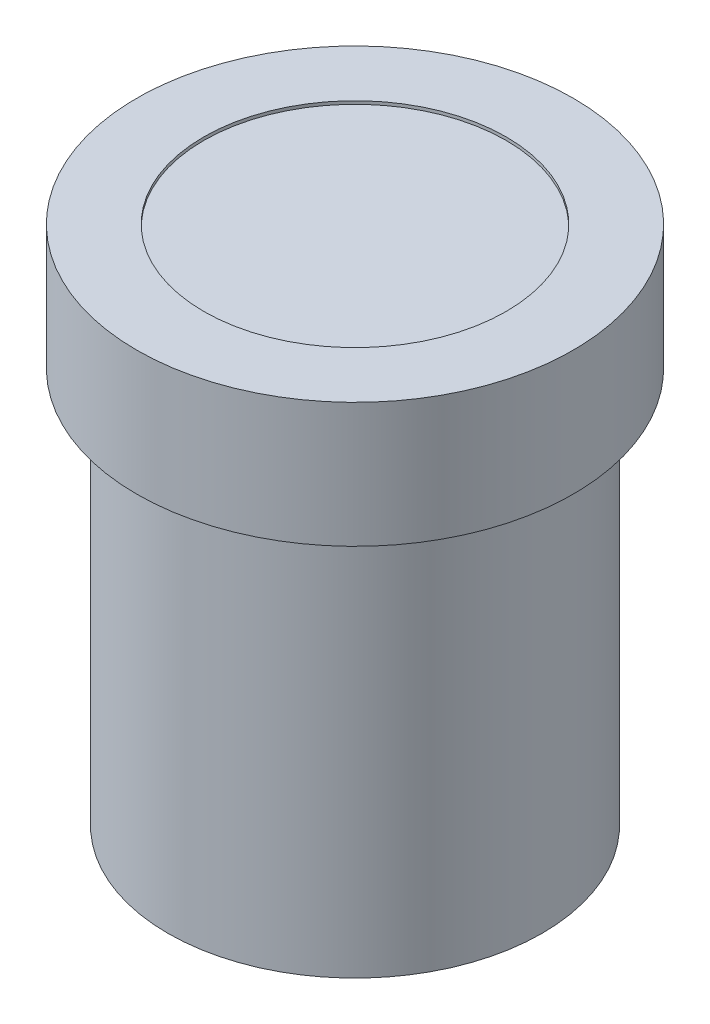
from build123d import *

# Parameters (mm, degrees)
SKETCH1_R           = 6
SKETCH1_R_2         = 2.25
BOSS_EXTRUDE1_DEPTH = 12.7
SKETCH2_R           = 7
SKETCH2_R_2         = 6
SKETCH2_R_3         = 4.85
BOSS_EXTRUDE2_DEPTH = 4
BOSS_EXTRUDE3_START = 3.8
SKETCH2_2_R         = 4.85
BOSS_EXTRUDE3_DEPTH = 0.1
SKETCH2_6_R         = 2.25
BOSS_EXTRUDE4_DEPTH = 0.1


# Read off the part's stored shape, not the designer's step: Dome1
with BuildPart() as part:
    # Sketch1 → Boss-Extrude1 (new body)
    with BuildSketch(Plane(origin=(0, 0, 0), x_dir=(1, 0, 0), z_dir=(0, 1, 0))):
        with Locations(Location((0, 0, 0), (0, 0, 270))):
            Circle(SKETCH1_R)
        with Locations(Location((0, 0, 0), (0, 0, 270))):
            Circle(SKETCH1_R_2, mode=Mode.SUBTRACT)
    extrude(amount=BOSS_EXTRUDE1_DEPTH)

    # Sketch2 → Boss-Extrude2 (add)
    # profile 1 of 2: a face of its own
    with BuildSketch(Plane(origin=(0, 12.7, 0), x_dir=(1, 0, 0), z_dir=(0, 1, 0))):
        with Locations(Location((0, 0, 0), (0, 0, 270))):
            Circle(SKETCH2_R)
        with Locations(Location((0, 0, 0), (0, 0, 270))):
            Circle(SKETCH2_R_2, mode=Mode.SUBTRACT)
    # profile 2 of 2: a face of its own
    with BuildSketch(Plane(origin=(0, 12.7, 0), x_dir=(1, 0, 0), z_dir=(0, 1, 0))):
        with Locations(Location((0, 0, 0), (0, 0, 270))):
            Circle(SKETCH2_R_2)
        with Locations(Location((0, 0, 0), (0, 0, 270))):
            Circle(SKETCH2_R_3, mode=Mode.SUBTRACT)
    extrude(amount=BOSS_EXTRUDE2_DEPTH)

    # Sketch2<2> → Boss-Extrude3 (add)
    with BuildSketch(Plane(origin=(0, 12.7, 0), x_dir=(1, 0, 0), z_dir=(0, 1, 0)).offset(BOSS_EXTRUDE3_START)):
        with Locations(Location((0, 0, 0), (0, 0, 270))):
            Circle(SKETCH2_2_R)
    extrude(amount=BOSS_EXTRUDE3_DEPTH)


with BuildPart() as body_2:
    # Sketch2<6> → Boss-Extrude4 (new body)
    with BuildSketch(Plane(origin=(0, 12.7, 0), x_dir=(1, 0, 0), z_dir=(0, 1, 0))):
        with Locations(Location((0, 0, 0), (0, 0, 270))):
            Circle(SKETCH2_6_R)
    extrude(amount=-BOSS_EXTRUDE4_DEPTH)

    # Dome1 outline → Dome1 (revolve)
    with BuildSketch(Plane.XY):
        with BuildLine():
            Line((0, 12.7), (2.25, 12.699999998))
            ThreePointArc((2.25, 12.699999998), (1.505199323, 14.127724237), (0, 14.7))
            Line((0, 14.7), (0, 12.7))
        make_face()
    revolve(axis=Axis((0, 0, 0), (0, 1, 0)))


solid = Compound([part.part, body_2.part])
